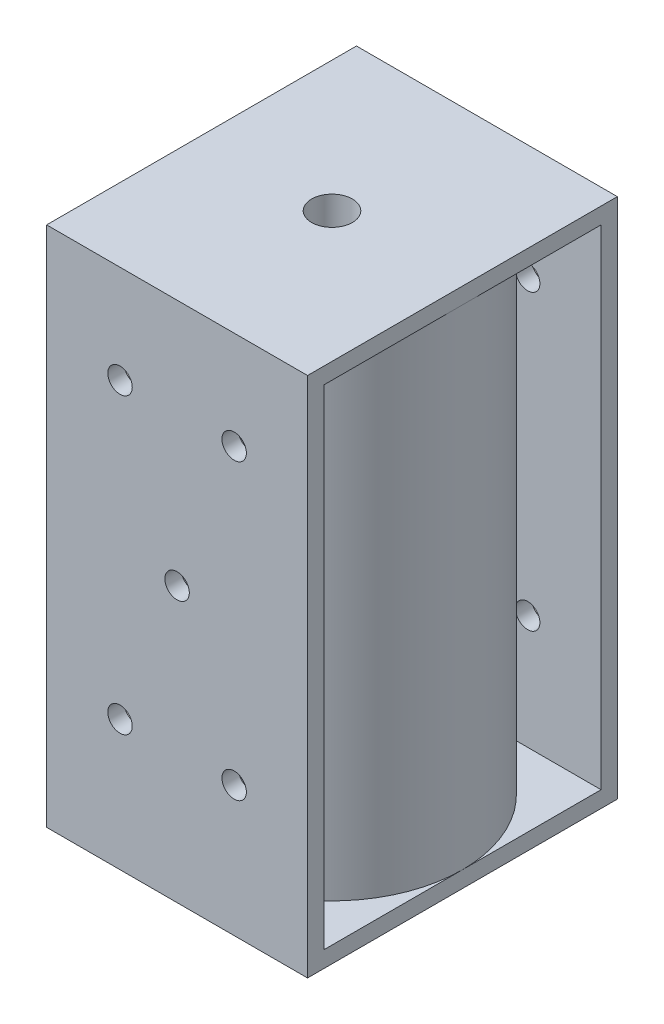
from build123d import *

# Parameters (mm, degrees)
SKETCH1_W           = 38
SKETCH1_H           = 64
SKETCH1_W_2         = 34
SKETCH1_H_2         = 60
BOSS_EXTRUDE1_DEPTH = 32
SKETCH2_R           = 1.5
CUT_EXTRUDE1_DEPTH  = 60.093146811
BOSS_EXTRUDE3_REACH = 74.312
SKETCH7_R           = 16
SKETCH8_R           = 2.5
CUT_EXTRUDE2_DEPTH  = 75.033776076
SKETCH9_R           = 6
CUT_EXTRUDE3_DEPTH  = 40


with BuildPart() as part:
    # Sketch1 → Boss-Extrude1 (new body)
    with BuildSketch(Plane(origin=(0, 0, 0), x_dir=(0, 0, -1), z_dir=(1, 0, 0))):
        Rectangle(SKETCH1_W, SKETCH1_H)
        Rectangle(SKETCH1_W_2, SKETCH1_H_2, mode=Mode.SUBTRACT)
    extrude(amount=BOSS_EXTRUDE1_DEPTH)

    # Sketch2 → Cut-Extrude1 (cut, through all)
    with BuildSketch(Plane.XY.offset(19)):
        with Locations((9, 20)):
            Circle(SKETCH2_R)
        with Locations((23, 20)):
            Circle(SKETCH2_R)
        with Locations((16, 1.663521733)):
            Circle(SKETCH2_R)
        with Locations((9, -16)):
            Circle(SKETCH2_R)
        with Locations((23, -16)):
            Circle(SKETCH2_R)
    extrude(amount=-CUT_EXTRUDE1_DEPTH, mode=Mode.SUBTRACT)

    # Sketch7 → Boss-Extrude3 (add, up to next)
    with BuildSketch(Plane(origin=(0, -30, 0), x_dir=(1, 0, 0), z_dir=(0, 1, 0)), mode=Mode.PRIVATE) as boss_extrude3_sk1:
        with Locations((16, 0)):
            Circle(SKETCH7_R)
    boss_extrude3_tool1 = extrude(boss_extrude3_sk1.sketch, amount=BOSS_EXTRUDE3_REACH, mode=Mode.PRIVATE) - part.part
    add(boss_extrude3_tool1.solids().sort_by_distance((16, -30, 0))[0])

    # Sketch8 → Cut-Extrude2 (cut, through all)
    with BuildSketch(Plane(origin=(0, 32, 0), x_dir=(1, 0, 0), z_dir=(0, 1, 0))):
        with Locations((16, 0)):
            Circle(SKETCH8_R)
    extrude(amount=-CUT_EXTRUDE2_DEPTH, mode=Mode.SUBTRACT)

    # Sketch9 → Cut-Extrude3 (cut)
    with BuildSketch(Plane.XZ.offset(32)):
        with Locations((16, 0)):
            Circle(SKETCH9_R)
    extrude(amount=-CUT_EXTRUDE3_DEPTH, mode=Mode.SUBTRACT)


solid = part.part
